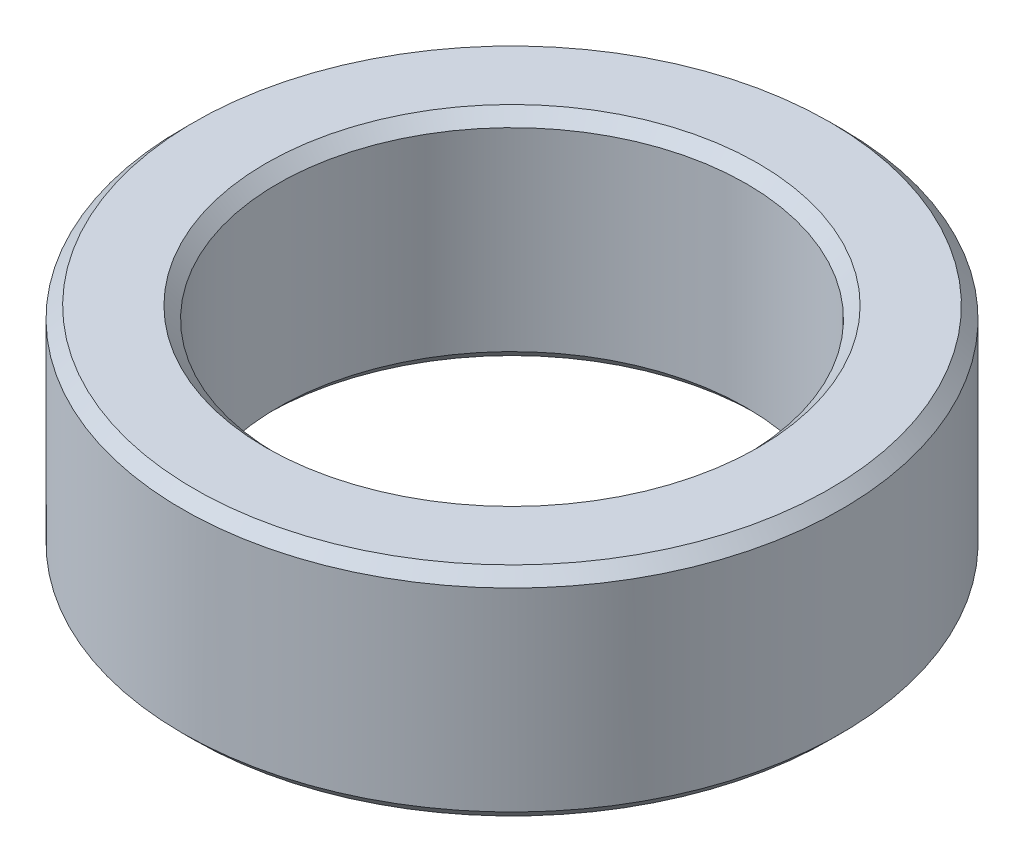
from build123d import *

# Parameters (mm, degrees)
SKETCH1_R           = 50
BOSS_EXTRUDE1_DEPTH = 32.991501344
SKETCH2_R           = 35.564900626
CUT_EXTRUDE1_DEPTH  = 79.028450971
CHAMFER1_SIZE       = 1.784420949


with BuildPart() as part:
    # Sketch1 → Boss-Extrude1 (new body)
    with BuildSketch(Plane(origin=(0, 0, 0), x_dir=(1, 0, 0), z_dir=(0, 1, 0))):
        Circle(SKETCH1_R)
    extrude(amount=BOSS_EXTRUDE1_DEPTH)

    # Sketch2 → Cut-Extrude1 (cut, through all)
    with BuildSketch(Plane(origin=(0, 0, 0), x_dir=(1, 0, 0), z_dir=(0, 1, 0))):
        Circle(SKETCH2_R)
    extrude(amount=CUT_EXTRUDE1_DEPTH, mode=Mode.SUBTRACT)

    # Chamfer1
    chamfer1_edges = [part.edges().sort_by_distance(p)[0] for p in [
        (-35.564900626, 32.991501344, 0),
        (-35.564900626, 0, 0),
        (-50, 0, 0),
        (-50, 32.991501344, 0),
    ]]
    chamfer(chamfer1_edges, length=CHAMFER1_SIZE)


solid = part.part
